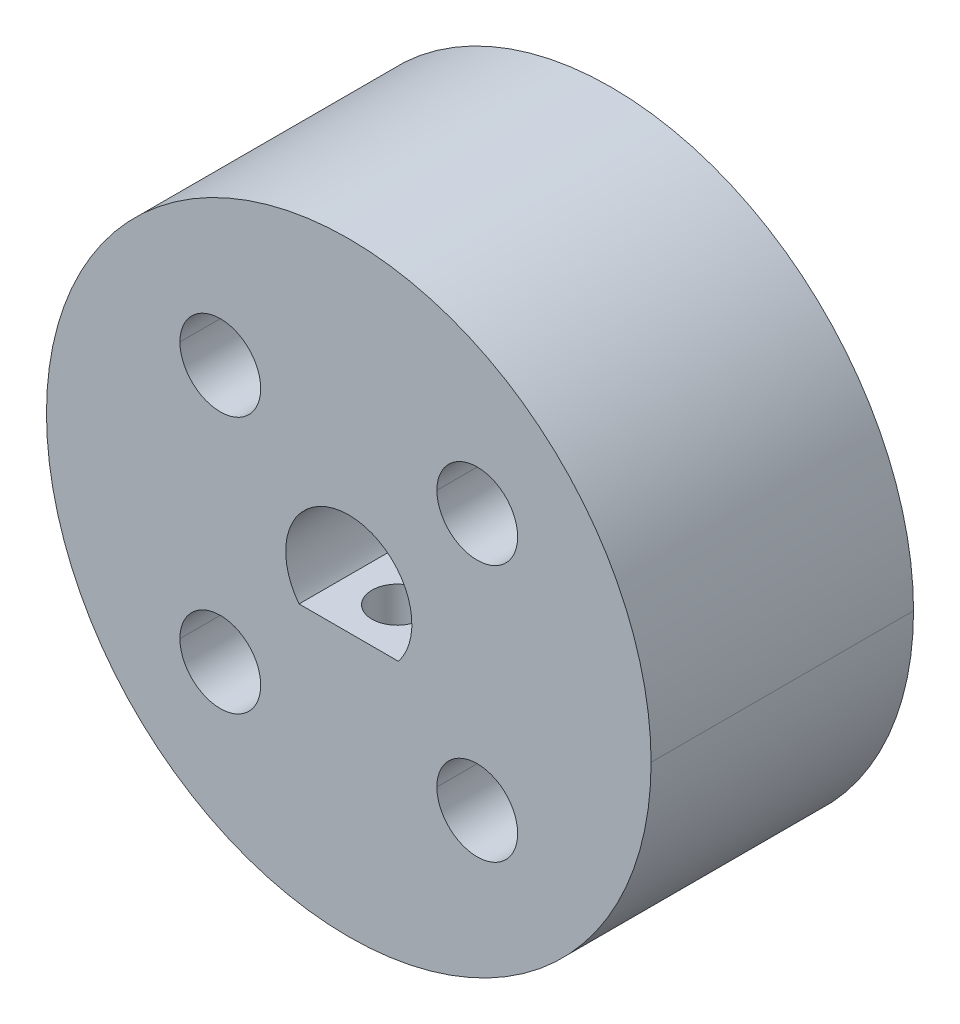
from build123d import *

# Parameters (mm, degrees)
CUT_EXTRUDE1_START       = -13
CUT_EXTRUDE1_OUTLINE_R   = 14.975
CUT_EXTRUDE1_OUTLINE_R_2 = 3.125
CUT_EXTRUDE1_DEPTH       = 13
CUT_EXTRUDE1_START_2     = -8
CUT_EXTRUDE1_2_OUTLINE_R = 2
CUT_EXTRUDE1_2_DEPTH     = 8
CUT_EXTRUDE3_DEPTH       = 5
BOSS_EXTRUDE1_DEPTH      = 13
CUT_EXTRUDE4_DEPTH       = 2
CUT_EXTRUDE4_DEPTH_BACK  = 22
BOSS_EXTRUDE2_REACH      = 26.85


with BuildPart() as part:
    # Cut-Extrude1: read off the stored shape, not the designer's step
    # Cut-Extrude1 outline → Cut-Extrude1 (new body)
    with BuildSketch(Plane.XY.offset(13).offset(CUT_EXTRUDE1_START)):
        Circle(CUT_EXTRUDE1_OUTLINE_R)
        Polygon((-6.363961031, -2.380244173), (-2.913961031, -4.372102602), (-2.913961031, -8.355819459), (-6.363961031, -10.347677888), (-9.813961031, -8.355819459), (-9.813961031, -4.372102602), align=None, mode=Mode.SUBTRACT)
        Polygon((9.813961031, -8.355819459), (6.363961031, -10.347677888), (2.913961031, -8.355819459), (2.913961031, -4.372102602), (6.363961031, -2.380244173), (9.813961031, -4.372102602), align=None, mode=Mode.SUBTRACT)
        Circle(CUT_EXTRUDE1_OUTLINE_R_2, mode=Mode.SUBTRACT)
        Polygon((-9.813961031, 8.355819459), (-6.363961031, 10.347677888), (-2.913961031, 8.355819459), (-2.913961031, 4.372102602), (-6.363961031, 2.380244173), (-9.813961031, 4.372102602), align=None, mode=Mode.SUBTRACT)
        Polygon((6.363961031, 2.380244173), (2.913961031, 4.372102602), (2.913961031, 8.355819459), (6.363961031, 10.347677888), (9.813961031, 8.355819459), (9.813961031, 4.372102602), align=None, mode=Mode.SUBTRACT)
    extrude(amount=CUT_EXTRUDE1_DEPTH)

    # Cut-Extrude1 2 outline → Cut-Extrude1 2 (add)
    # profile 1 of 4: a face of its own
    with BuildSketch(Plane.XY.offset(13).offset(CUT_EXTRUDE1_START_2)):
        Polygon((2.913961031, -8.355819459), (6.363961031, -10.347677888), (9.813961031, -8.355819459), (9.813961031, -4.372102602), (6.363961031, -2.380244173), (2.913961031, -4.372102602), align=None)
        with Locations((6.363961031, -6.363961031)):
            Circle(CUT_EXTRUDE1_2_OUTLINE_R, mode=Mode.SUBTRACT)
    # profile 2 of 4: a face of its own
    with BuildSketch(Plane.XY.offset(13).offset(CUT_EXTRUDE1_START_2)):
        Polygon((-2.913961031, -8.355819459), (-2.913961031, -4.372102602), (-6.363961031, -2.380244173), (-9.813961031, -4.372102602), (-9.813961031, -8.355819459), (-6.363961031, -10.347677888), align=None)
        with Locations((-6.363961031, -6.363961031)):
            Circle(CUT_EXTRUDE1_2_OUTLINE_R, mode=Mode.SUBTRACT)
    # profile 3 of 4: a face of its own
    with BuildSketch(Plane.XY.offset(13).offset(CUT_EXTRUDE1_START_2)):
        Polygon((-2.913961031, 8.355819459), (-6.363961031, 10.347677888), (-9.813961031, 8.355819459), (-9.813961031, 4.372102602), (-6.363961031, 2.380244173), (-2.913961031, 4.372102602), align=None)
        with Locations((-6.363961031, 6.363961031)):
            Circle(CUT_EXTRUDE1_2_OUTLINE_R, mode=Mode.SUBTRACT)
    # profile 4 of 4: a face of its own
    with BuildSketch(Plane.XY.offset(13).offset(CUT_EXTRUDE1_START_2)):
        Polygon((2.913961031, 8.355819459), (2.913961031, 4.372102602), (6.363961031, 2.380244173), (9.813961031, 4.372102602), (9.813961031, 8.355819459), (6.363961031, 10.347677888), align=None)
        with Locations((6.363961031, 6.363961031)):
            Circle(CUT_EXTRUDE1_2_OUTLINE_R, mode=Mode.SUBTRACT)
    extrude(amount=CUT_EXTRUDE1_2_DEPTH)

    # Cut-Extrude1 3: loft between two sections, ruled curve by curve
    cut_extrude1_3_from = [
        Edge.make_three_point_arc((0, 14.975, 1.45), (1.449568901, 14.975, 2.050431099), (2.05, 14.975, 3.5)),
        Edge.make_three_point_arc((2.05, 14.975, 3.5), (1.449568901, 14.975, 4.949568901), (0, 14.975, 5.55)),
        Edge.make_three_point_arc((0, 14.975, 5.55), (-1.449568901, 14.975, 4.949568901), (-2.05, 14.975, 3.5)),
        Edge.make_three_point_arc((-2.05, 14.975, 3.5), (-1.449568901, 14.975, 2.050431099), (0, 14.975, 1.45)),
    ]
    cut_extrude1_3_to = [
        Edge.make_three_point_arc((0, 2.358384549, 1.45), (1.449568901, 2.358384549, 2.050431099), (2.05, 2.358384549, 3.5)),
        Edge.make_three_point_arc((2.05, 2.358384549, 3.5), (1.449568901, 2.358384549, 4.949568901), (0, 2.358384549, 5.55)),
        Edge.make_three_point_arc((0, 2.358384549, 5.55), (-1.449568901, 2.358384549, 4.949568901), (-2.05, 2.358384549, 3.5)),
        Edge.make_three_point_arc((-2.05, 2.358384549, 3.5), (-1.449568901, 2.358384549, 2.050431099), (0, 2.358384549, 1.45)),
    ]
    cut_extrude1_3 = Solid(Shell([*[Face.make_surface_from_curves(cut_extrude1_3_from[k], cut_extrude1_3_to[k]) for k in range(4)], Face(Wire(cut_extrude1_3_from)), Face(Wire(cut_extrude1_3_to))]))
    add(cut_extrude1_3, mode=Mode.SUBTRACT)

    # Cut-Extrude1 4: loft between two sections, ruled curve by curve
    cut_extrude1_4_from = [
        Edge.make_three_point_arc((0, 14.975, 7.45), (1.449568901, 14.975, 8.050431099), (2.05, 14.975, 9.5)),
        Edge.make_three_point_arc((2.05, 14.975, 9.5), (1.449568901, 14.975, 10.949568901), (0, 14.975, 11.55)),
        Edge.make_three_point_arc((0, 14.975, 11.55), (-1.449568901, 14.975, 10.949568901), (-2.05, 14.975, 9.5)),
        Edge.make_three_point_arc((-2.05, 14.975, 9.5), (-1.449568901, 14.975, 8.050431099), (0, 14.975, 7.45)),
    ]
    cut_extrude1_4_to = [
        Edge.make_three_point_arc((0, 2.358384549, 7.45), (1.449568901, 2.358384549, 8.050431099), (2.05, 2.358384549, 9.5)),
        Edge.make_three_point_arc((2.05, 2.358384549, 9.5), (1.449568901, 2.358384549, 10.949568901), (0, 2.358384549, 11.55)),
        Edge.make_three_point_arc((0, 2.358384549, 11.55), (-1.449568901, 2.358384549, 10.949568901), (-2.05, 2.358384549, 9.5)),
        Edge.make_three_point_arc((-2.05, 2.358384549, 9.5), (-1.449568901, 2.358384549, 8.050431099), (0, 2.358384549, 7.45)),
    ]
    cut_extrude1_4 = Solid(Shell([*[Face.make_surface_from_curves(cut_extrude1_4_from[k], cut_extrude1_4_to[k]) for k in range(4)], Face(Wire(cut_extrude1_4_from)), Face(Wire(cut_extrude1_4_to))]))
    add(cut_extrude1_4, mode=Mode.SUBTRACT)

    # Sketch2 → Cut-Extrude3 (cut)
    with BuildSketch(Plane(origin=(0, 0, 0), x_dir=(-1, 0, 0), z_dir=(0, 0, -1))):
        Polygon((2.813961031, 8.413554486), (2.813961031, 4.314367575), (6.363961031, 2.264774119), (9.913961031, 4.314367575), (9.913961031, 8.413554486), (6.363961031, 10.463147942), align=None)
    extrude(amount=-CUT_EXTRUDE3_DEPTH, mode=Mode.SUBTRACT)

    # Sketch4 → Boss-Extrude1 (add)
    with BuildSketch(Plane(origin=(0, 0, 0), x_dir=(-1, 0, 0), z_dir=(0, 0, -1))):
        with BuildLine():
            ThreePointArc((-2.461706725, -1.925), (-1.369306394, -2.809025632), (0, -3.125))
            Line((0, -3.125), (0, -1.925))
            Line((0, -1.925), (-2.461706725, -1.925))
        make_face()
        with BuildLine():
            Line((0, -1.925), (0, -3.125))
            ThreePointArc((0, -3.125), (1.369306394, -2.809025632), (2.461706725, -1.925))
            Line((2.461706725, -1.925), (0, -1.925))
        make_face()
    extrude(amount=-BOSS_EXTRUDE1_DEPTH)

    # Sketch3 → Cut-Extrude4 (cut, two sides: drawn at the far end of the back side and taken through both)
    with BuildSketch(Plane(origin=(0, 0, 0), x_dir=(1, 0, 0), z_dir=(0, 1, 0)).offset(-CUT_EXTRUDE4_DEPTH_BACK)):
        with BuildLine():
            ThreePointArc((0, -4.5), (-1.5, -6), (0, -7.5))
            Line((0, -7.5), (0, -4.5))
        make_face()
        with BuildLine():
            Line((0, -4.5), (0, -7.5))
            ThreePointArc((0, -7.5), (1.060660172, -7.060660172), (1.5, -6))
            ThreePointArc((1.5, -6), (1.060660172, -4.939339828), (0, -4.5))
        make_face()
        with BuildLine():
            ThreePointArc((0, -9.350905038), (-1.25, -10.600905038), (0, -11.850905038))
            Line((0, -11.850905038), (0, -9.350905038))
        make_face()
        with BuildLine():
            Line((0, -9.350905038), (0, -11.850905038))
            ThreePointArc((0, -11.850905038), (0.883883476, -11.484788515), (1.25, -10.600905038))
            ThreePointArc((1.25, -10.600905038), (0.883883476, -9.717021562), (0, -9.350905038))
        make_face()
    extrude(amount=CUT_EXTRUDE4_DEPTH + CUT_EXTRUDE4_DEPTH_BACK, mode=Mode.SUBTRACT)

    # Sketch5 → Boss-Extrude2 (add, up to next)
    with BuildSketch(Plane(origin=(0, 0, 0), x_dir=(-1, 0, 0), z_dir=(0, 0, -1)), mode=Mode.PRIVATE) as boss_extrude2_sk1:
        with BuildLine():
            Line((-4.568894393, 14.260989763), (-3.6536631, 9.845398343))
            Line((-3.6536631, 9.845398343), (-2.698785597, 9.845398343))
            Line((-2.698785597, 9.845398343), (-2.04137138, 2.366099721))
            ThreePointArc((-2.04137138, 2.366099721), (0, 3.125), (2.04137138, 2.366099721))
            Line((2.04137138, 2.366099721), (2.335168556, 11.338349863))
            Line((2.335168556, 11.338349863), (6.630079619, 11.338349863))
            Line((6.630079619, 11.338349863), (8.4371537, 9.779282306))
            Line((8.4371537, 9.779282306), (9.782251652, 11.338349863))
            ThreePointArc((9.782251652, 11.338349863), (2.988348955, 14.673799628), (-4.568894393, 14.260989763))
        make_face()
    boss_extrude2_tool1 = extrude(boss_extrude2_sk1.sketch, amount=-BOSS_EXTRUDE2_REACH, mode=Mode.PRIVATE) - part.part
    add(boss_extrude2_tool1.solids().sort_by_distance((-0.855715, 10.107885, 0))[0])
    add(boss_extrude2_tool1.solids().sort_by_distance((-0.855715, 10.107885, 0))[1])


solid = part.part
